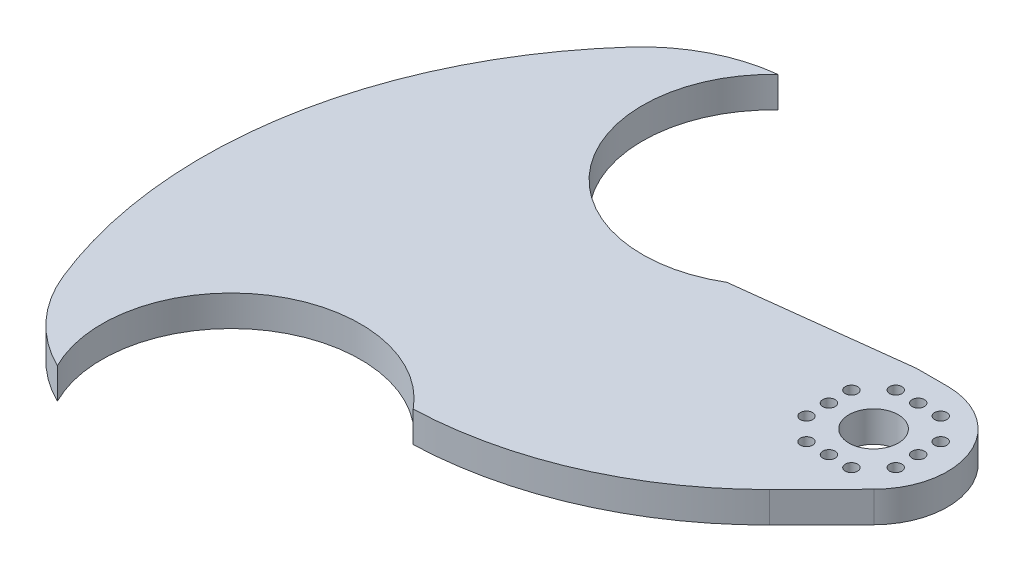
from build123d import *

# Parameters (mm, degrees)
ESQUISSE1_R        = 4
ESQUISSE1_R_2      = 1
BOSS_EXTRU_1_DEPTH = 5


with BuildPart() as part:
    # Esquisse1 → Boss.-Extru.1 (new body)
    with BuildSketch(Plane(origin=(0, 0, 0), x_dir=(1, 0, 0), z_dir=(0, 1, 0))):
        with BuildLine():
            Line((-32.525247325, 8.692622551), (-5, 12))
            Line((-5, 12), (0, 12))
            ThreePointArc((0, 12), (11.075776241, 4.618136058), (8.524906938, -8.445469892))
            Line((8.524906938, -8.445469892), (0.079437047, -16.97037683))
            ThreePointArc((0.079437047, -16.97037683), (-18.357290047, -29.623702355), (-40.158361015, -34.596916346))
            ThreePointArc((-40.158361015, -34.596916346), (-67.881903442, -30.299408579), (-75.138547111, -57.39930711))
            ThreePointArc((-75.138547111, -57.39930711), (-82.386253207, -51.993107392), (-87.236864352, -44.362392449))
            ThreePointArc((-87.236864352, -44.362392449), (-91.57056602, -3.213826072), (-73.424579973, 33.970964842))
            ThreePointArc((-73.424579973, 33.970964842), (-66.256638254, 39.482484647), (-57.596993116, 42.08378915))
            ThreePointArc((-57.596993116, 42.08378915), (-60.046689789, 14.136296168), (-32.525247325, 8.692622551))
        make_face()
        Circle(ESQUISSE1_R, mode=Mode.SUBTRACT)
        with Locations((7.25, -3.65)):
            Circle(ESQUISSE1_R_2, mode=Mode.SUBTRACT)
        with Locations((7.25, 0)):
            Circle(ESQUISSE1_R_2, mode=Mode.SUBTRACT)
        with Locations((7.25, 3.65)):
            Circle(ESQUISSE1_R_2, mode=Mode.SUBTRACT)
        with Locations((3.65, -7.25)):
            Circle(ESQUISSE1_R_2, mode=Mode.SUBTRACT)
        with Locations((0, -7.25)):
            Circle(ESQUISSE1_R_2, mode=Mode.SUBTRACT)
        with Locations((-3.65, -7.25)):
            Circle(ESQUISSE1_R_2, mode=Mode.SUBTRACT)
        with Locations((-7.25, -3.65)):
            Circle(ESQUISSE1_R_2, mode=Mode.SUBTRACT)
        with Locations((-7.25, 0)):
            Circle(ESQUISSE1_R_2, mode=Mode.SUBTRACT)
        with Locations((-7.25, 3.65)):
            Circle(ESQUISSE1_R_2, mode=Mode.SUBTRACT)
        with Locations((-3.65, 7.25)):
            Circle(ESQUISSE1_R_2, mode=Mode.SUBTRACT)
        with Locations((0, 7.25)):
            Circle(ESQUISSE1_R_2, mode=Mode.SUBTRACT)
        with Locations((3.65, 7.25)):
            Circle(ESQUISSE1_R_2, mode=Mode.SUBTRACT)
    extrude(amount=BOSS_EXTRU_1_DEPTH)


solid = part.part
